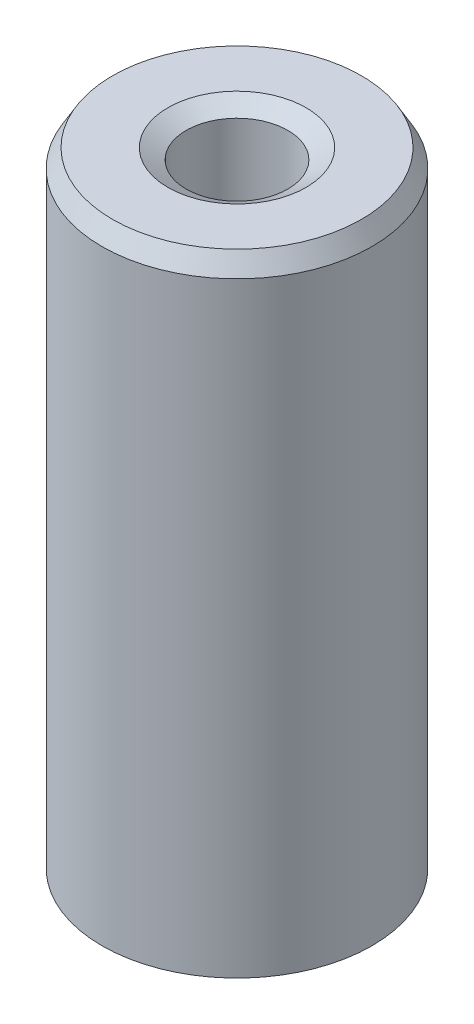
from build123d import *
from OCP.BRepFilletAPI import BRepFilletAPI_MakeChamfer

# Parameters (mm, degrees)
SKETCH1_R           = 25
BOSS_EXTRUDE1_DEPTH = 117.474514255
SKETCH2_R           = 9.417278929
CUT_EXTRUDE1_DEPTH  = 123.679507252
CHAMFER1_SIZE       = 3.379731787
CHAMFER1_SIZE2      = 1.951289057


with BuildPart() as part:
    # Sketch1 → Boss-Extrude1 (new body)
    with BuildSketch(Plane(origin=(0, 0, 0), x_dir=(1, 0, 0), z_dir=(0, 1, 0))):
        Circle(SKETCH1_R)
    extrude(amount=BOSS_EXTRUDE1_DEPTH)

    # Sketch2 → Cut-Extrude1 (cut, through all)
    with BuildSketch(Plane(origin=(0, 0, 0), x_dir=(1, 0, 0), z_dir=(0, 1, 0))):
        Circle(SKETCH2_R)
    extrude(amount=CUT_EXTRUDE1_DEPTH, mode=Mode.SUBTRACT)

    # Chamfer1: one chamfer whose edges measure the first distance from different faces: ONE call of the kernel's chamfer builder (chamfer() names one face for all edges)
    chamfer1_edges_1 = [part.edges().sort_by_distance(p)[0] for p in [
        (-9.417278929, 117.474514255, 0),
    ]]
    chamfer1_side_1 = [part.faces().sort_by_distance(p)[0] for p in [
        (-24.292893219, 117.474514255, 0),
    ]]
    chamfer1_edges_2 = [part.edges().sort_by_distance(p)[0] for p in [
        (-9.417278929, 0, 0),
    ]]
    chamfer1_side_2 = [part.faces().sort_by_distance(p)[0] for p in [
        (-9.417278929, 58.737257128, 0),
    ]]
    chamfer1_edges_3 = [part.edges().sort_by_distance(p)[0] for p in [
        (-25, 0, 0),
    ]]
    chamfer1_side_3 = [part.faces().sort_by_distance(p)[0] for p in [
        (-24.292893219, 0, 0),
    ]]
    chamfer1_edges_4 = [part.edges().sort_by_distance(p)[0] for p in [
        (-25, 117.474514255, 0),
    ]]
    chamfer1_side_4 = [part.faces().sort_by_distance(p)[0] for p in [
        (-25, 58.737257128, 0),
    ]]
    chamfer1 = BRepFilletAPI_MakeChamfer(part.part.solid().wrapped)
    for e in chamfer1_edges_1:
        chamfer1.Add(CHAMFER1_SIZE, CHAMFER1_SIZE2, e.wrapped, chamfer1_side_1[0].wrapped)  # the first distance lies on this face
    for e in chamfer1_edges_2:
        chamfer1.Add(CHAMFER1_SIZE, CHAMFER1_SIZE2, e.wrapped, chamfer1_side_2[0].wrapped)  # the first distance lies on this face
    for e in chamfer1_edges_3:
        chamfer1.Add(CHAMFER1_SIZE, CHAMFER1_SIZE2, e.wrapped, chamfer1_side_3[0].wrapped)  # the first distance lies on this face
    for e in chamfer1_edges_4:
        chamfer1.Add(CHAMFER1_SIZE, CHAMFER1_SIZE2, e.wrapped, chamfer1_side_4[0].wrapped)  # the first distance lies on this face
    add(Compound.cast(chamfer1.Shape()), mode=Mode.REPLACE)


solid = part.part
